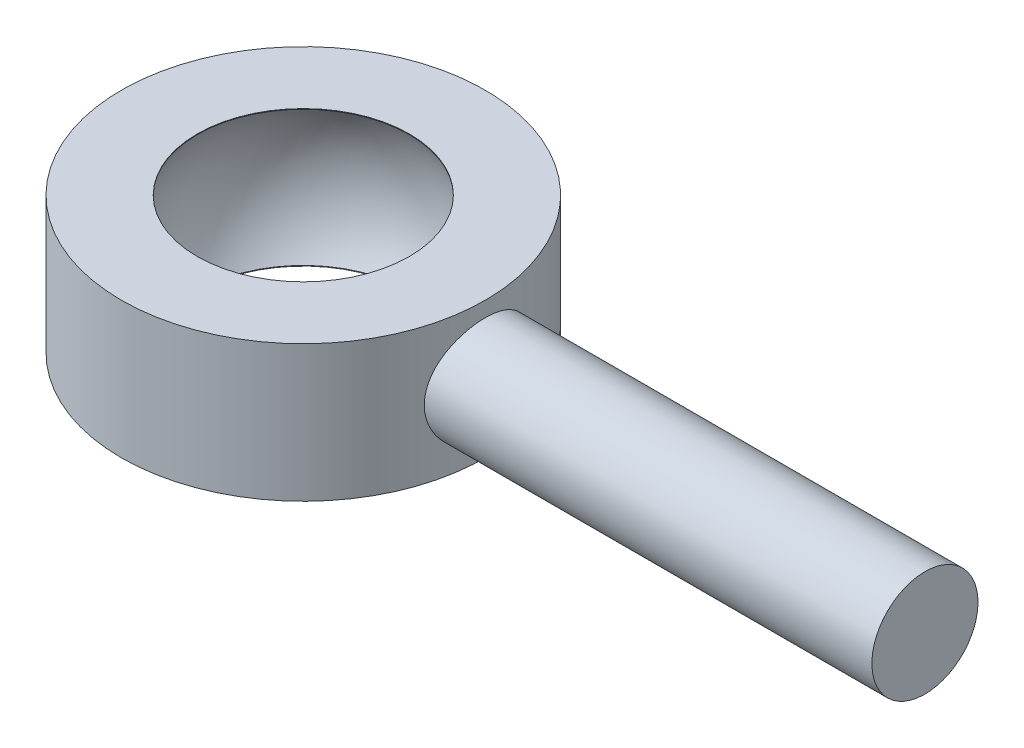
from build123d import *

# Parameters (mm, degrees)
BOSS_EXTRUDE2_DEPTH      = 29
BOSS_EXTRUDE2_DEPTH_BACK = 2
SKETCH1_R                = 3.5
BOSS_EXTRUDE3_DEPTH      = 4.5
BOSS_EXTRUDE3_DEPTH_BACK = 4.5
SKETCH2_R                = 12
SKETCH2_R_2              = 7


# Read off the part's stored shape, not the designer's step: Cut-Revolve-Thin4
with BuildPart() as part:
    # Sketch1 → Boss-Extrude2 (new, two sides: drawn at the far end of the back side and taken through both)
    with BuildSketch(Plane.YZ.offset(-BOSS_EXTRUDE2_DEPTH_BACK)):
        with Locations(Location((0, 0, 0), (0, 0, 270))):
            Circle(SKETCH1_R)
    extrude(amount=BOSS_EXTRUDE2_DEPTH + BOSS_EXTRUDE2_DEPTH_BACK)

    # Sketch2 → Boss-Extrude3 (add, two sides: drawn at the far end of the back side and taken through both)
    with BuildSketch(Plane(origin=(0, 0, 0), x_dir=(-1, 0, 0), z_dir=(0, 1, 0)).offset(-BOSS_EXTRUDE3_DEPTH_BACK)):
        with Locations(Location((12, 0, 0), (0, 0, 90))):
            Circle(SKETCH2_R)
        with Locations(Location((12, 0, 0), (0, 0, 90))):
            Circle(SKETCH2_R_2, mode=Mode.SUBTRACT)
    extrude(amount=BOSS_EXTRUDE3_DEPTH + BOSS_EXTRUDE3_DEPTH_BACK)

    # Cut-Revolve-Thin4 outline → Cut-Revolve-Thin4 (revolve, cut)
    with BuildSketch(Plane(origin=(-12, 0, 0), x_dir=(1, 0, 0), z_dir=(0, 0, 1))):
        with BuildLine():
            Line((6.999999996, 4.459820631), (6.999999996, -4.459820631))
            ThreePointArc((6.999999996, -4.459820631), (8.3, 0), (6.999999996, 4.459820631))
        make_face()
    revolve(axis=Axis((-12, 0, 0), (0, 1, 0)), mode=Mode.SUBTRACT)


solid = part.part
